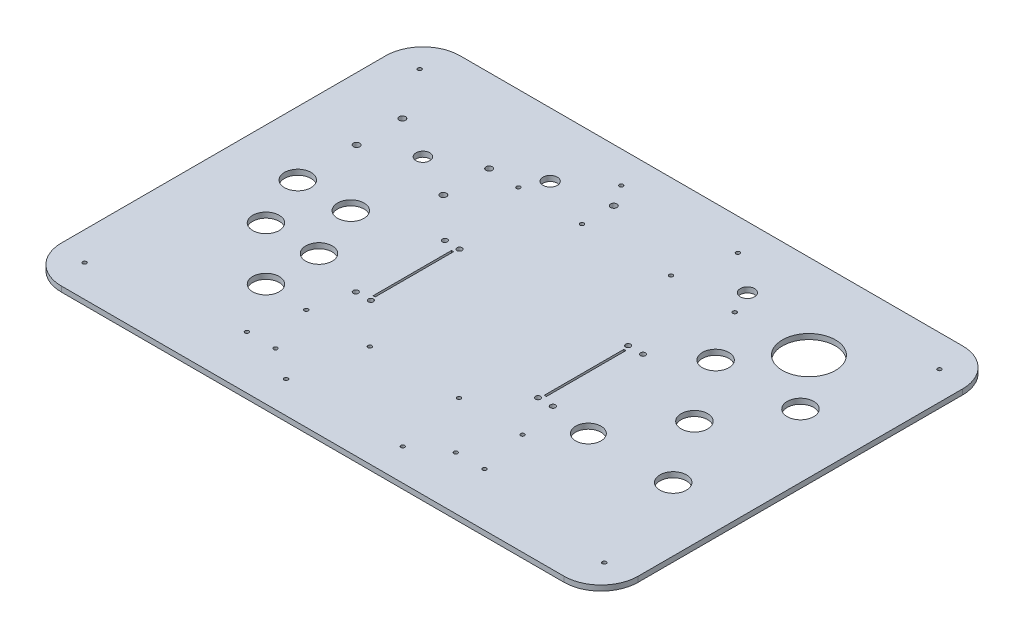
from build123d import *

# Parameters (mm, degrees)
SKETCH1_W               = 544
SKETCH1_H               = 376
BOSS_EXTRUDE1_DEPTH     = 5
SKETCH2_R               = 6.5
SKETCH2_R_2             = 3
F_1_JOYYSTICK_DEPTH     = 662.314599869
SKETCH3_R               = 12.5
F_1_BUTTONS_DEPTH       = 662.314599869
SKETCH4_R               = 6.75
F_1_ROCKET_SWITCH_DEPTH = 662.314599869
SKETCH5_R               = 2.4
SKETCH5_W               = 2
SKETCH5_H               = 74
F_1_POTENTIOMETER_DEPTH = 662.314599869
FILLET1_R               = 35
SKETCH6_R               = 12.5
SKETCH6_R_2             = 12
F_2_BUTTONS_DEPTH       = 662.314599869
SKETCH9_R               = 25
F_2_SPEAKER_DEPTH       = 662.314599869
SKETCH10_R              = 6.75
F_2_ROCKET_SWITCH_DEPTH = 662.314599869
SKETCH8_R               = 2.4
SKETCH8_W               = 2
SKETCH8_H               = 75
F_2_POTENTIOMETER_DEPTH = 662.314599869
SKETCH11_R              = 1.8
F_2_PCB1_DEPTH          = 662.314599869
SKETCH12_R              = 1.8
F_1_PCB2_DEPTH          = 662.314599869
SKETCH13_R              = 1.8
F_2_USB_CONNECTOR_DEPTH = 662.314599869
SKETCH14_R              = 1.8
F_1_USB_CONNECTOR_DEPTH = 662.314599869
SKETCH15_R              = 3
POWER_DEPTH             = 662.314599869
SKETCH16_R              = 1.8
LED_FIXINGS_DEPTH       = 662.314599869


with BuildPart() as part:
    # Sketch1 → Boss-Extrude1 (new body)
    with BuildSketch(Plane(origin=(0, 0, 0), x_dir=(1, 0, 0), z_dir=(0, 1, 0))):
        with Locations((272, 188)):
            Rectangle(SKETCH1_W, SKETCH1_H)
    extrude(amount=BOSS_EXTRUDE1_DEPTH)

    # Sketch2 → 1 Joyystick (cut, through all)
    with BuildSketch(Plane(origin=(0, 5, 0), x_dir=(1, 0, 0), z_dir=(0, 1, 0))):
        with Locations((100, 276)):
            Circle(SKETCH2_R)
        with Locations((140.91, 297.59)):
            Circle(SKETCH2_R_2)
        with Locations((140.91, 254.41)):
            Circle(SKETCH2_R_2)
        with Locations((59.09, 254.41)):
            Circle(SKETCH2_R_2)
        with Locations((59.09, 297.59)):
            Circle(SKETCH2_R_2)
    extrude(amount=-F_1_JOYYSTICK_DEPTH, mode=Mode.SUBTRACT)

    # Sketch3 → 1 Buttons (cut, through all)
    with BuildSketch(Plane(origin=(0, 5, 0), x_dir=(1, 0, 0), z_dir=(0, 1, 0))):
        with Locations((60, 198)):
            Circle(SKETCH3_R)
        with Locations((110, 198)):
            Circle(SKETCH3_R)
        with Locations((80, 148)):
            Circle(SKETCH3_R)
        with Locations((130, 148)):
            Circle(SKETCH3_R)
        with Locations((130, 98)):
            Circle(SKETCH3_R)
    extrude(amount=-F_1_BUTTONS_DEPTH, mode=Mode.SUBTRACT)

    # Sketch4 → 1 Rocket Switch (cut, through all)
    with BuildSketch(Plane(origin=(0, 5, 0), x_dir=(1, 0, 0), z_dir=(0, 1, 0))):
        with Locations((180, 316)):
            Circle(SKETCH4_R)
    extrude(amount=-F_1_ROCKET_SWITCH_DEPTH, mode=Mode.SUBTRACT)

    # Sketch5 → 1 Potentiometer (cut, through all)
    with BuildSketch(Plane(origin=(0, 5, 0), x_dir=(1, 0, 0), z_dir=(0, 1, 0))):
        with Locations((178.719749064, 218)):
            Circle(SKETCH5_R)
        with Locations((192.718338039, 217.801237073)):
            Circle(SKETCH5_R)
        with Locations((192.718338039, 134.198762927)):
            Circle(SKETCH5_R)
        with Locations((178.719749064, 134)):
            Circle(SKETCH5_R)
        with Locations((191, 176)):
            Rectangle(SKETCH5_W, SKETCH5_H)
    extrude(amount=-F_1_POTENTIOMETER_DEPTH, mode=Mode.SUBTRACT)

    # Fillet1
    fillet1_edges = [part.edges().sort_by_distance(p)[0] for p in [
        (0, 2.5, 0),
        (544, 2.5, 0),
        (544, 2.5, -376),
        (0, 2.5, -376),
    ]]
    fillet(fillet1_edges, radius=FILLET1_R)

    # Sketch6 → 2 Buttons (cut, through all)
    with BuildSketch(Plane(origin=(0, 5, 0), x_dir=(1, 0, 0), z_dir=(0, 1, 0))):
        with Locations((484, 248)):
            Circle(SKETCH6_R)
        with Locations((404, 248)):
            Circle(SKETCH6_R)
        with Locations((484, 128)):
            Circle(SKETCH6_R)
        with Locations((404, 128)):
            Circle(SKETCH6_R_2)
        with Locations((444, 188)):
            Circle(SKETCH6_R)
    extrude(amount=-F_2_BUTTONS_DEPTH, mode=Mode.SUBTRACT)

    # Sketch9 → 2 speaker (cut, through all)
    with BuildSketch(Plane(origin=(0, 5, 0), x_dir=(1, 0, 0), z_dir=(0, 1, 0))):
        with Locations((444, 296)):
            Circle(SKETCH9_R)
    extrude(amount=-F_2_SPEAKER_DEPTH, mode=Mode.SUBTRACT)

    # Sketch10 → 2 Rocket Switch (cut, through all)
    with BuildSketch(Plane(origin=(0, 5, 0), x_dir=(1, 0, 0), z_dir=(0, 1, 0))):
        with Locations((364, 318)):
            Circle(SKETCH10_R)
    extrude(amount=-F_2_ROCKET_SWITCH_DEPTH, mode=Mode.SUBTRACT)

    # Sketch8 → 2 Potentiometer (cut, through all)
    with BuildSketch(Plane(origin=(0, 5, 0), x_dir=(1, 0, 0), z_dir=(0, 1, 0))):
        with Locations((365, 218.5)):
            Circle(SKETCH8_R)
        with Locations((365, 133.5)):
            Circle(SKETCH8_R)
        with Locations((351, 133.5)):
            Circle(SKETCH8_R)
        with Locations((351, 218.5)):
            Circle(SKETCH8_R)
        with Locations((353, 176)):
            Rectangle(SKETCH8_W, SKETCH8_H)
    extrude(amount=-F_2_POTENTIOMETER_DEPTH, mode=Mode.SUBTRACT)

    # Sketch11 → 2 PCB1 (cut, through all)
    with BuildSketch(Plane(origin=(0, 5, 0), x_dir=(1, 0, 0), z_dir=(0, 1, 0))):
        with Locations((374, 96)):
            Circle(SKETCH11_R)
        with Locations((314, 96)):
            Circle(SKETCH11_R)
        with Locations((314, 296)):
            Circle(SKETCH11_R)
        with Locations((374, 296)):
            Circle(SKETCH11_R)
    extrude(amount=-F_2_PCB1_DEPTH, mode=Mode.SUBTRACT)

    # Sketch12 → 1 PCB2 (cut, through all)
    with BuildSketch(Plane(origin=(0, 5, 0), x_dir=(1, 0, 0), z_dir=(0, 1, 0))):
        with Locations((230, 96)):
            Circle(SKETCH12_R)
        with Locations((170, 96)):
            Circle(SKETCH12_R)
        with Locations((230, 296)):
            Circle(SKETCH12_R)
        with Locations((170, 296)):
            Circle(SKETCH12_R)
    extrude(amount=-F_1_PCB2_DEPTH, mode=Mode.SUBTRACT)

    # Sketch13 → 2 USB Connector (cut, through all)
    with BuildSketch(Plane(origin=(0, 5, 0), x_dir=(1, 0, 0), z_dir=(0, 1, 0))):
        with Locations((384, 50)):
            Circle(SKETCH13_R)
        with Locations((357, 50)):
            Circle(SKETCH13_R)
    extrude(amount=-F_2_USB_CONNECTOR_DEPTH, mode=Mode.SUBTRACT)

    # Sketch14 → 1 USB Connector (cut, through all)
    with BuildSketch(Plane(origin=(0, 5, 0), x_dir=(1, 0, 0), z_dir=(0, 1, 0))):
        with Locations((187, 50)):
            Circle(SKETCH14_R)
        with Locations((160, 50)):
            Circle(SKETCH14_R)
    extrude(amount=-F_1_USB_CONNECTOR_DEPTH, mode=Mode.SUBTRACT)

    # Sketch15 → Power (cut, through all)
    with BuildSketch(Plane(origin=(0, 5, 0), x_dir=(1, 0, 0), z_dir=(0, 1, 0))):
        with Locations((230, 326)):
            Circle(SKETCH15_R)
    extrude(amount=-POWER_DEPTH, mode=Mode.SUBTRACT)

    # Sketch16 → LED fixings (cut, through all)
    with BuildSketch(Plane(origin=(0, 5, 0), x_dir=(1, 0, 0), z_dir=(0, 1, 0))):
        with Locations((517, 30)):
            Circle(SKETCH16_R)
        with Locations((327, 30)):
            Circle(SKETCH16_R)
        with Locations((517, 346)):
            Circle(SKETCH16_R)
        with Locations((327, 346)):
            Circle(SKETCH16_R)
        with Locations((217, 346)):
            Circle(SKETCH16_R)
        with Locations((27, 346)):
            Circle(SKETCH16_R)
        with Locations((217, 30)):
            Circle(SKETCH16_R)
        with Locations((27, 30)):
            Circle(SKETCH16_R)
    extrude(amount=-LED_FIXINGS_DEPTH, mode=Mode.SUBTRACT)


solid = part.part
